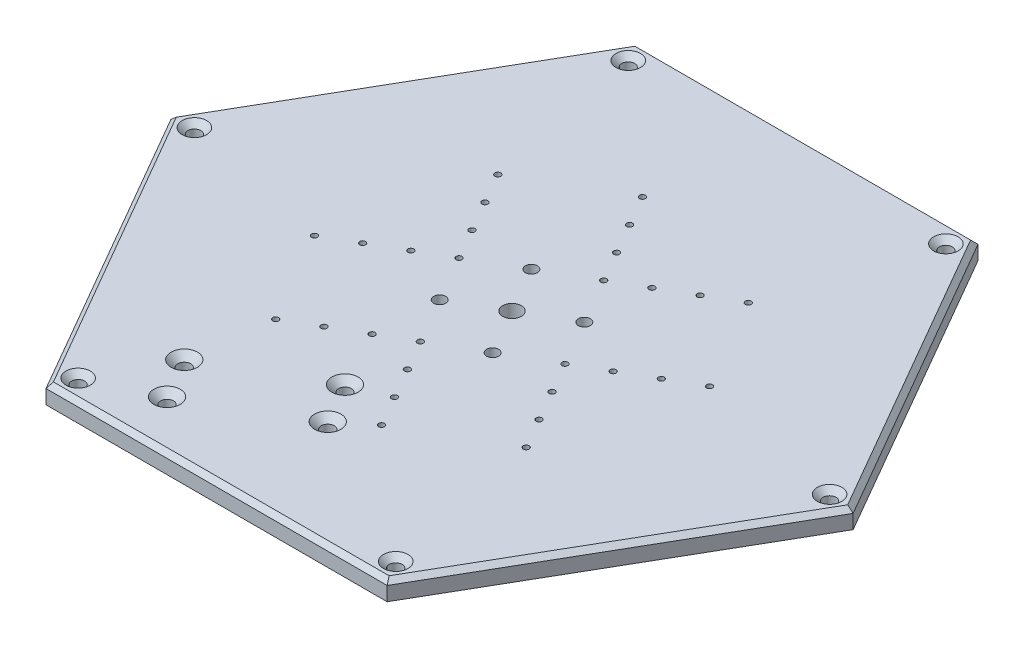
from build123d import *

# Parameters (mm, degrees)
BOSS_EXTRUDE1_DEPTH                             = 8
CSK_FOR_M5_FLAT_HEAD_MACHINE_SCREW2_D           = 5.5
CSK_FOR_M5_FLAT_HEAD_MACHINE_SCREW2_DEPTH       = 10
CSK_FOR_M5_FLAT_HEAD_MACHINE_SCREW2_CSINK_D     = 10.4
CSK_FOR_M5_FLAT_HEAD_MACHINE_SCREW2_CSINK_ANGLE = 90
CSK_FOR_M5_FLAT_HEAD_MACHINE_SCREW2_TIP         = 1.652366702
CHAMFER4_SIZE                                   = 2
CSK_FOR_M5_SFHCS1_D                             = 5.5
CSK_FOR_M5_SFHCS1_DEPTH                         = 10
CSK_FOR_M5_SFHCS1_CSINK_D                       = 11.2
CSK_FOR_M5_SFHCS1_CSINK_ANGLE                   = 90
CSK_FOR_M5_SFHCS1_TIP                           = 1.652366702
M3X0_5_TAPPED_HOLE1_D                           = 2.5
F_1_4_20_TAPPED_HOLE1_D                         = 5.1054
F_3_8_16_TAPPED_HOLE1_D                         = 7.9375


with BuildPart() as part:
    # Sketch1 → Boss-Extrude1 (new body)
    with BuildSketch(Plane(origin=(0, 0, 0), x_dir=(1, 0, 0), z_dir=(0, 1, 0))):
        Polygon((72.5, 125.573683549), (-72.5, 125.573683549), (-145, 0), (-72.5, -125.573683549), (72.5, -125.573683549), (145, 0), align=None)
    extrude(amount=BOSS_EXTRUDE1_DEPTH)

    # CSK for M5 Flat Head Machine Screw2
    with Locations(Plane(origin=(0, 8, 0), x_dir=(1, 0, 0), z_dir=(0, 1, 0))):
        with Locations((-135, 0), (-67.5, -116.913429511), (67.5, -116.913429511), (135, 0), (67.5, 116.913429511), (-67.5, 116.913429511)):
            CounterSinkHole(CSK_FOR_M5_FLAT_HEAD_MACHINE_SCREW2_D / 2, CSK_FOR_M5_FLAT_HEAD_MACHINE_SCREW2_CSINK_D / 2, depth=CSK_FOR_M5_FLAT_HEAD_MACHINE_SCREW2_DEPTH, counter_sink_angle=CSK_FOR_M5_FLAT_HEAD_MACHINE_SCREW2_CSINK_ANGLE)
            with Locations((0, 0, -(CSK_FOR_M5_FLAT_HEAD_MACHINE_SCREW2_DEPTH + CSK_FOR_M5_FLAT_HEAD_MACHINE_SCREW2_TIP / 2))):  # 118° drill point
                Cone(0, CSK_FOR_M5_FLAT_HEAD_MACHINE_SCREW2_D / 2, CSK_FOR_M5_FLAT_HEAD_MACHINE_SCREW2_TIP, mode=Mode.SUBTRACT)

    # Chamfer4
    chamfer4_edges = [part.edges().sort_by_distance(p)[0] for p in [
        (0, 8, 125.573683549),
        (108.75, 8, 62.786841774),
        (108.75, 8, -62.786841774),
        (0, 8, -125.573683549),
        (-108.75, 8, -62.786841774),
        (-108.75, 8, 62.786841774),
    ]]
    chamfer(chamfer4_edges, length=CHAMFER4_SIZE)

    # CSK for M5 SFHCS1
    with Locations(Plane(origin=(0, 8, 0), x_dir=(1, 0, 0), z_dir=(0, 1, 0))):
        with Locations((1.594210129, -79.908620039), (-8.405789871, -62.588111964), (-51.70706006, -87.588111964), (-41.70706006, -104.908620039)):
            CounterSinkHole(CSK_FOR_M5_SFHCS1_D / 2, CSK_FOR_M5_SFHCS1_CSINK_D / 2, depth=CSK_FOR_M5_SFHCS1_DEPTH, counter_sink_angle=CSK_FOR_M5_SFHCS1_CSINK_ANGLE)
            with Locations((0, 0, -(CSK_FOR_M5_SFHCS1_DEPTH + CSK_FOR_M5_SFHCS1_TIP / 2))):  # 118° drill point
                Cone(0, CSK_FOR_M5_SFHCS1_D / 2, CSK_FOR_M5_SFHCS1_TIP, mode=Mode.SUBTRACT)

    # M3x0.5 Tapped Hole1 (through all)
    with Locations(Plane(origin=(0, 8, 0), x_dir=(1, 0, 0), z_dir=(0, 1, 0))):
        with Locations((47.206714755, 53.235571585), (69.706714755, 14.264428415), (56.716333699, 6.764428415), (34.216333699, 45.735571585), (21.225952642, 38.235571585), (43.725952642, -0.735571585), (38.235571585, -21.225952642), (45.735571585, -34.216333699), (53.235571585, -47.206714755), (14.264428415, -69.706714755), (6.764428415, -56.716333699), (-0.735571585, -43.725952642), (-8.235571585, -30.735571585), (-30.735571585, 8.235571585), (8.235571585, 30.735571585), (30.735571585, -8.235571585), (0.735571585, 43.725952642), (-6.764428415, 56.716333699), (-14.264428415, 69.706714755), (-53.235571585, 47.206714755), (-45.735571585, 34.216333699), (-38.235571585, 21.225952642), (-43.725952642, 0.735571585), (-56.716333699, -6.764428415), (-69.706714755, -14.264428415), (-47.206714755, -53.235571585), (-34.216333699, -45.735571585), (-21.225952642, -38.235571585)):
            Hole(M3X0_5_TAPPED_HOLE1_D / 2)

    # 1/4-20 Tapped Hole1 (through all)
    with Locations(Plane(origin=(0, 8, 0), x_dir=(1, 0, 0), z_dir=(0, 1, 0))):
        with Locations((19.485571585, 11.25), (-11.25, 19.485571585), (-19.485571585, -11.25), (11.25, -19.485571585)):
            Hole(F_1_4_20_TAPPED_HOLE1_D / 2)

    # 3/8-16 Tapped Hole1 (through all)
    with Locations(Plane(origin=(0, 8, 0), x_dir=(1, 0, 0), z_dir=(0, 1, 0))):
        with Locations((0, 0)):
            Hole(F_3_8_16_TAPPED_HOLE1_D / 2)


solid = part.part
